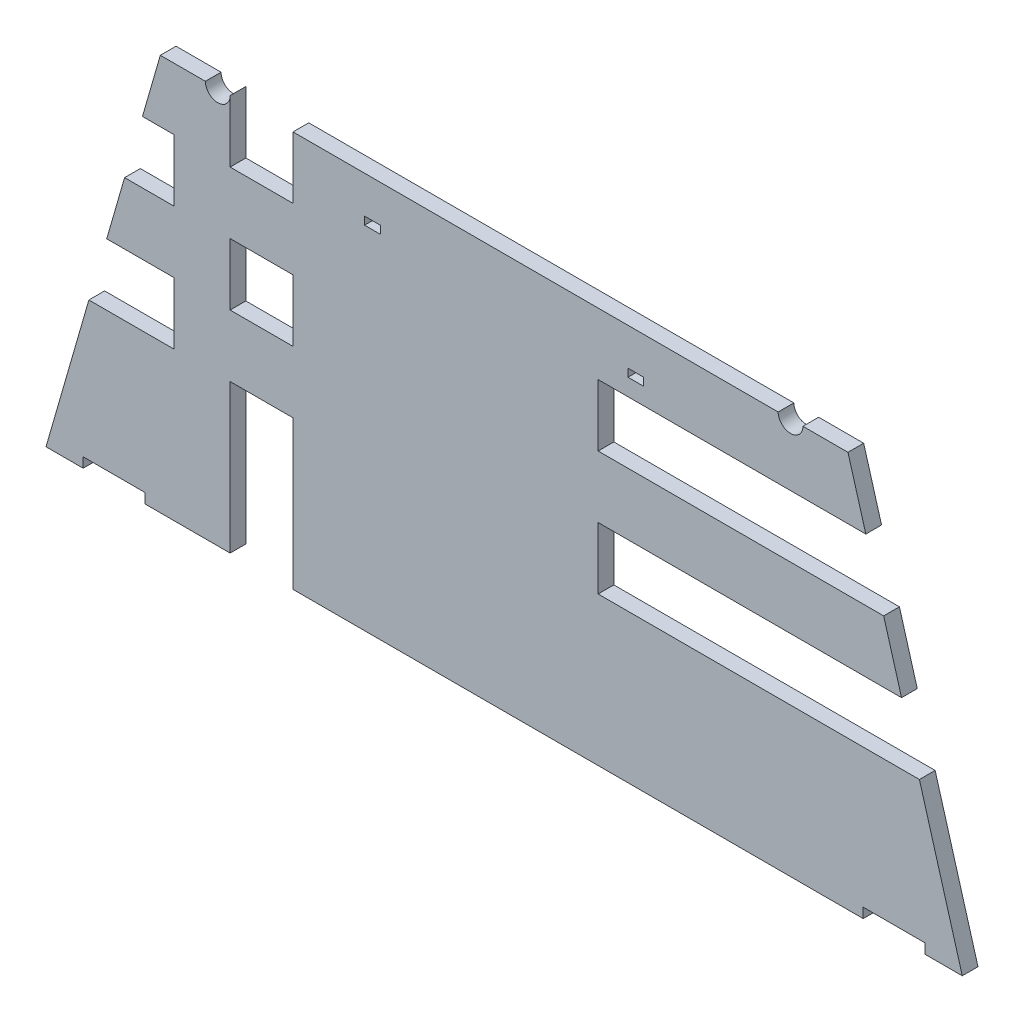
from build123d import *

# Parameters (mm, degrees)
SKETCH1_W      = 6.35
SKETCH1_H      = 3.175
SKETCH1_W_2    = 25.4
SKETCH1_H_2    = 25
EXTRUDE1_DEPTH = 6.35


with BuildPart() as part:
    # Sketch1 → Extrude1 (new body)
    with BuildSketch(Plane.XY):
        with BuildLine():
            Line((-145, 0), (-145, 4))
            Line((-145, 4), (-170, 4))
            Line((-170, 4), (-170, 0))
            Line((-170, 0), (-185, 0))
            Line((-185, 0), (-167.688888889, 60))
            Line((-167.688888889, 60), (-133.35, 60))
            Line((-133.35, 60), (-133.35, 85))
            Line((-133.35, 85), (-160.475925926, 85))
            Line((-160.475925926, 85), (-153.262962963, 110))
            Line((-153.262962963, 110), (-133.35, 110))
            Line((-133.35, 110), (-133.35, 135))
            Line((-133.35, 135), (-146.05, 135))
            Line((-146.05, 135), (-138.837037037, 160))
            Line((-138.837037037, 160), (-120.65, 160))
            ThreePointArc((-120.65, 160), (-115.65, 155), (-110.65, 160))
            Line((-110.65, 160), (-110.65, 135))
            Line((-110.65, 135), (-85.25, 135))
            Line((-85.25, 135), (-85.25, 160))
            Line((-85.25, 160), (0, 160))
            Line((0, 160), (110.65, 160))
            ThreePointArc((110.65, 160), (115.65, 155), (120.65, 160))
            Line((120.65, 160), (138.837037037, 160))
            Line((138.837037037, 160), (146.05, 135))
            Line((146.05, 135), (37.95, 135))
            Line((37.95, 135), (37.95, 110))
            Line((37.95, 110), (153.262962963, 110))
            Line((153.262962963, 110), (160.475925926, 85))
            Line((160.475925926, 85), (37.95, 85))
            Line((37.95, 85), (37.95, 60))
            Line((37.95, 60), (167.688888889, 60))
            Line((167.688888889, 60), (185, 0))
            Line((185, 0), (170, 0))
            Line((170, 0), (170, 4))
            Line((170, 4), (145, 4))
            Line((145, 4), (145, 0))
            Line((145, 0), (-85.25, 0))
            Line((-85.25, 0), (-85.25, 60))
            Line((-85.25, 60), (-110.65, 60))
            Line((-110.65, 60), (-110.65, 0))
            Line((-110.65, 0), (-145, 0))
        make_face()
        with Locations((-53.175, 143.4125)):
            Rectangle(SKETCH1_W, SKETCH1_H, mode=Mode.SUBTRACT)
        with Locations((-97.95, 97.5)):
            Rectangle(SKETCH1_W_2, SKETCH1_H_2, mode=Mode.SUBTRACT)
        with Locations((53.175, 143.4125)):
            Rectangle(SKETCH1_W, SKETCH1_H, mode=Mode.SUBTRACT)
    extrude(amount=EXTRUDE1_DEPTH)


solid = part.part
